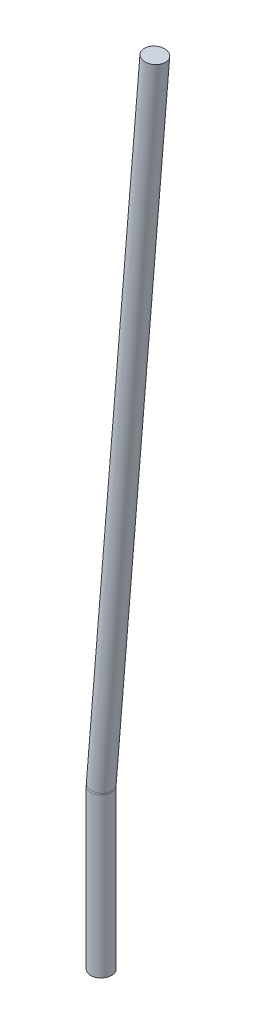
from build123d import *

# Parameters (mm, degrees)
SKETCH1_R           = 0.2
BOSS_EXTRUDE1_DEPTH = 3
SKETCH2_R           = 0.2
REVOLVE1_ANGLE      = 4.66
SKETCH3_R           = 0.2
BOSS_EXTRUDE2_DEPTH = 12.5


with BuildPart() as part:
    # Sketch1 → Boss-Extrude1 (new body)
    with BuildSketch(Plane(origin=(0, 0, 0), x_dir=(1, 0, 0), z_dir=(0, 1, 0))):
        Circle(SKETCH1_R)
    extrude(amount=-BOSS_EXTRUDE1_DEPTH)

    # Sketch2 → Revolve1 (revolve)
    with BuildSketch(Plane(origin=(0, 0, 0), x_dir=(1, 0, 0), z_dir=(0, 1, 0))):
        Circle(SKETCH2_R)
    revolve(axis=Axis((0.5, 0, -0.2), (0, 0, -1)), revolution_arc=REVOLVE1_ANGLE)

    # Sketch3 → Boss-Extrude2 (add)
    with BuildSketch(Plane(origin=(0.003300189, 0.040487072, 0), x_dir=(0.9966943478093031, -0.08124270456470586, 0), z_dir=(0.08124270456470586, 0.9966943478093031, 0))):
        with Locations((-0.001652826, 0)):
            Circle(SKETCH3_R)
    extrude(amount=BOSS_EXTRUDE2_DEPTH)


solid = part.part
